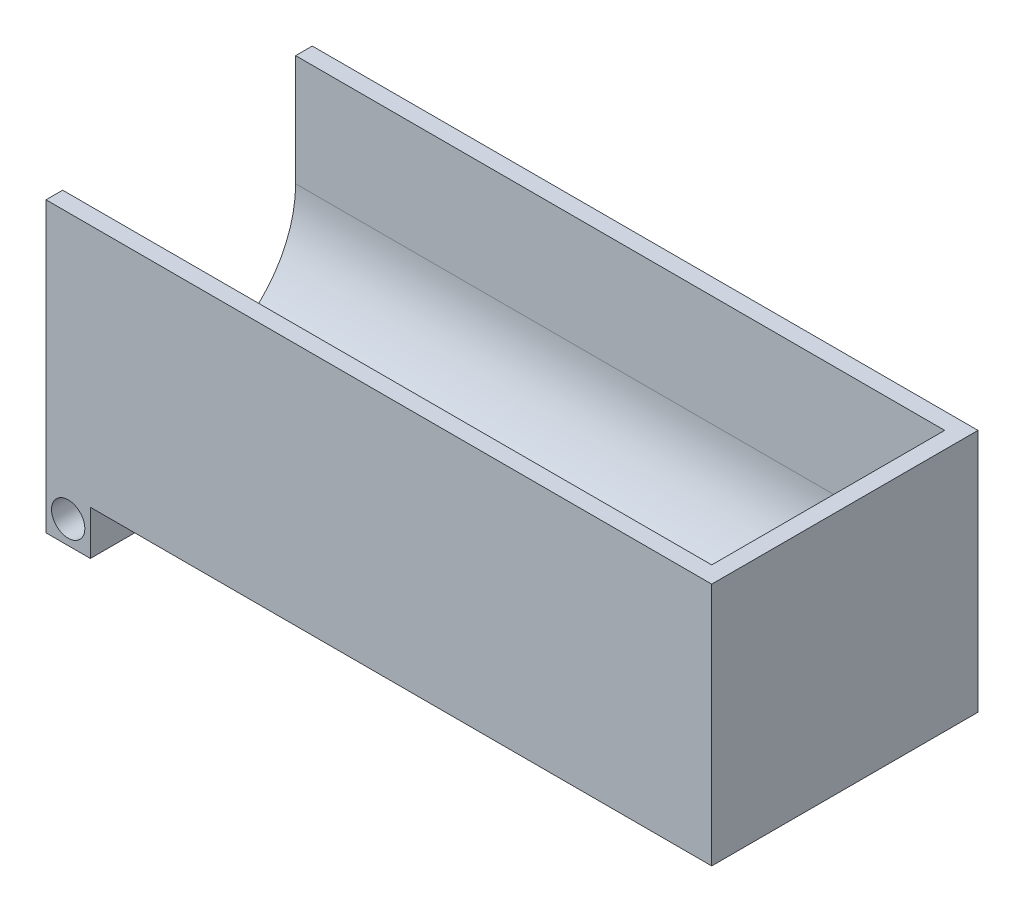
from build123d import *

# Parameters (mm, degrees)
BOSS_EXTRUDE1_DEPTH = 120
SKETCH2_W           = 8
SKETCH2_H           = 8
BOSS_EXTRUDE2_DEPTH = 48
CUT_EXTRUDE1_REACH  = 135.147
SKETCH3_R           = 3
SKETCH4_W           = 48
SKETCH4_H           = 24
BOSS_EXTRUDE3_DEPTH = 3
SKETCH5_W           = 6
SKETCH5_H           = 3
BOSS_EXTRUDE4_DEPTH = 5
SKETCH6_R           = 0.75
CUT_EXTRUDE2_DEPTH  = 129.842888822
BOSS_EXTRUDE5_DEPTH = 20


with BuildPart() as part:
    # Sketch1 → Boss-Extrude1 (new body)
    with BuildSketch(Plane(origin=(0, 0, 0), x_dir=(0, 0, -1), z_dir=(1, 0, 0))):
        with BuildLine():
            Line((21, 0), (24, 0))
            Line((24, 0), (24, -24))
            Line((24, -24), (-24, -24))
            Line((-24, -24), (-24, 0))
            Line((-24, 0), (-21, 0))
            ThreePointArc((-21, 0), (0, -21), (21, 0))
        make_face()
    extrude(amount=BOSS_EXTRUDE1_DEPTH)

    # Sketch2 → Boss-Extrude2 (add)
    with BuildSketch(Plane.XY.offset(24)):
        with Locations((4, -28)):
            Rectangle(SKETCH2_W, SKETCH2_H)
    extrude(amount=-BOSS_EXTRUDE2_DEPTH)

    # Sketch3 → Cut-Extrude1 (cut, up to next)
    with BuildSketch(Plane.XY.offset(24), mode=Mode.PRIVATE) as cut_extrude1_sk1:
        with Locations((4, -27.835840809)):
            Circle(SKETCH3_R)
    cut_extrude1_tool1 = extrude(cut_extrude1_sk1.sketch, amount=-CUT_EXTRUDE1_REACH, mode=Mode.PRIVATE) & part.part
    add(cut_extrude1_tool1.solids().sort_by_distance((4, -27.835841, 24))[0], mode=Mode.SUBTRACT)

    # Sketch4 → Boss-Extrude3 (add)
    with BuildSketch(Plane(origin=(120, 0, 0), x_dir=(0, 0, -1), z_dir=(1, 0, 0))):
        with Locations((0, -12)):
            Rectangle(SKETCH4_W, SKETCH4_H)
    extrude(amount=-BOSS_EXTRUDE3_DEPTH)

    # Sketch5 → Boss-Extrude4 (add)
    with BuildSketch(Plane.XZ.offset(24)):
        with Locations((31, -11.8)):
            Rectangle(SKETCH5_W, SKETCH5_H)
    extrude(amount=BOSS_EXTRUDE4_DEPTH)

    # Sketch6 → Cut-Extrude2 (cut, through all)
    with BuildSketch(Plane.XY.offset(-10.3)):
        with Locations((31, -26.5)):
            Circle(SKETCH6_R)
    extrude(amount=-CUT_EXTRUDE2_DEPTH, mode=Mode.SUBTRACT)

    # Sketch7 → Boss-Extrude5 (add)
    with BuildSketch(Plane(origin=(0, 0, 0), x_dir=(1, 0, 0), z_dir=(0, 1, 0))):
        Polygon((120, 24), (0, 24), (0, 21), (117, 21), (117, -21), (0, -21), (0, -24), (120, -24), align=None)
    extrude(amount=BOSS_EXTRUDE5_DEPTH)


solid = part.part
